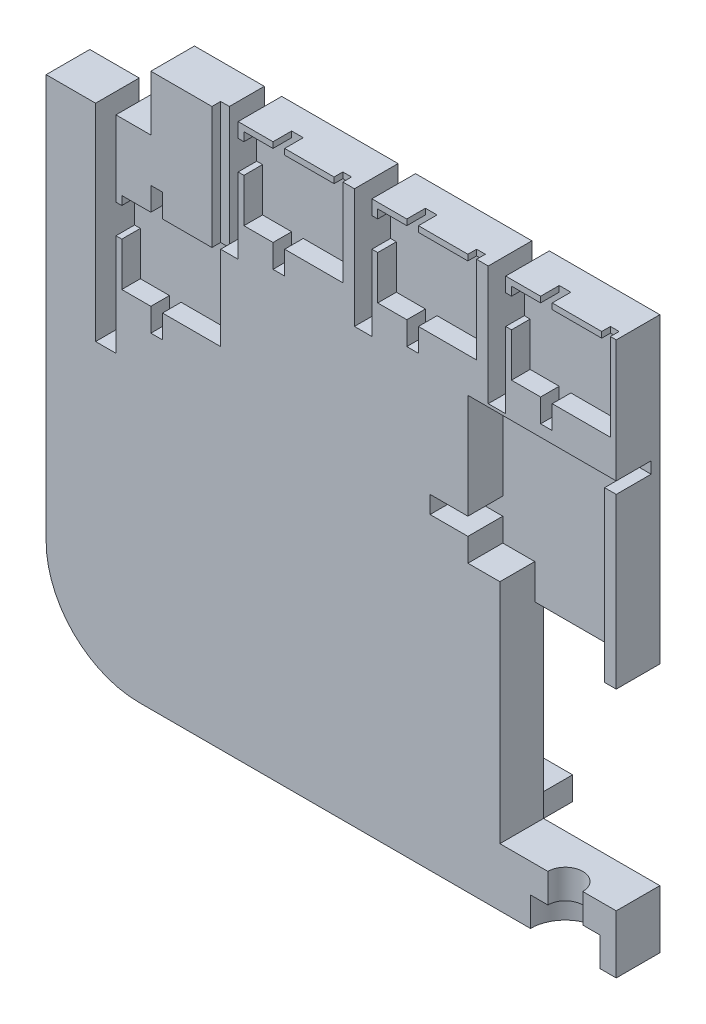
from build123d import *
from OCP.BRepAlgoAPI import BRepAlgoAPI_Cut
from OCP.TopTools import TopTools_ListOfShape
from build123d.topology import SkipClean

# Parameters (mm, degrees)
BOSS_EXTRUDE1_DEPTH = 7.5
CUT_EXTRUDE1_DEPTH  = 3.2
CUT_EXTRUDE4_REACH  = 70.655
SKETCH5_W           = 3
SKETCH5_H           = 17
CUT_EXTRUDE5_REACH  = 70.655
SKETCH8_W           = 12
SKETCH8_H           = 37
CUT_EXTRUDE6_DEPTH  = 3.2
SKETCH10_W          = 10
SKETCH10_H          = 7.5
BOSS_EXTRUDE2_DEPTH = 27.486353186
SKETCH11_W          = 3
SKETCH11_H          = 7.5
CUT_EXTRUDE7_DEPTH  = 3.5
SKETCH12_W          = 2
SKETCH12_H          = 7.5
CUT_EXTRUDE8_DEPTH  = 4
SKETCH13_W          = 2
SKETCH13_H          = 7.5
CUT_EXTRUDE9_DEPTH  = 4
SKETCH14_W          = 7.5
SKETCH14_H          = 9.5
CUT_EXTRUDE10_DEPTH = 6
SKETCH15_W          = 1.5
SKETCH15_H          = 21
SKETCH15_H_2        = 1
CUT_EXTRUDE11_DEPTH = 1.5
SKETCH16_W          = 1.5
SKETCH16_H          = 7.5
CUT_EXTRUDE12_DEPTH = 35.486360958
CUT_EXTRUDE13_DEPTH = 6
SKETCH19_W          = 17.5
SKETCH19_H          = 32
BOSS_EXTRUDE3_DEPTH = 7.5
CUT_EXTRUDE14_DEPTH = 6
SKETCH20_W          = 18
SKETCH20_H          = 6
CUT_EXTRUDE15_DEPTH = 6
SKETCH21_W          = 20
SKETCH21_H          = 33
CUT_EXTRUDE16_DEPTH = 11
CUT_EXTRUDE17_DEPTH = 5
CUT_EXTRUDE18_DEPTH = 10
SKETCH23_W          = 50
SKETCH23_H          = 4
BOSS_EXTRUDE4_DEPTH = 15
SKETCH25_R          = 3.5
CUT_EXTRUDE19_DEPTH = 10


with BuildPart() as part:
    # Sketch1 → Boss-Extrude1 (new body)
    with BuildSketch(Plane.XY):
        with BuildLine():
            Line((-33, -47.5), (49, -47.5))
            Line((49, -47.5), (49, -29.5))
            Line((49, -29.5), (31.5, -29.5))
            Line((31.5, -29.5), (31.5, 2.5))
            Line((31.5, 2.5), (49, 2.5))
            Line((49, 2.5), (49, 47.5))
            Line((49, 47.5), (30, 47.5))
            Line((30, 47.5), (30, 30.5))
            Line((30, 30.5), (27, 30.5))
            Line((27, 30.5), (27, 47.5))
            Line((27, 47.5), (-49, 47.5))
            Line((-49, 47.5), (-49, -31.5))
            ThreePointArc((-49, -31.5), (-44.313708499, -42.813708499), (-33, -47.5))
        make_face()
    extrude(amount=BOSS_EXTRUDE1_DEPTH)

    # Sketch2 → Cut-Extrude1 (cut)
    with BuildSketch(Plane.XY.offset(7.5)):
        Polygon((30, 40), (31, 40), (31, 32.5), (36, 32.5), (36, 28.5), (38, 28.5), (38, 32.5), (48, 32.5), (48, 46.5), (38, 46.5), (38, 47.5), (36, 47.5), (36, 46.5), (31, 46.5), (31, 45), (30, 45), align=None)
        Polygon((-16, 40), (-15, 40), (-15, 32.5), (-10, 32.5), (-10, 28.5), (-8, 28.5), (-8, 32.5), (2, 32.5), (2, 46.5), (-8, 46.5), (-8, 47.5), (-10, 47.5), (-10, 46.5), (-15, 46.5), (-15, 45), (-16, 45), align=None)
        Polygon((7, 40), (8, 40), (8, 32.5), (13, 32.5), (13, 28.5), (15, 28.5), (15, 32.5), (25, 32.5), (25, 46.5), (15, 46.5), (15, 47.5), (13, 47.5), (13, 46.5), (8, 46.5), (8, 45), (7, 45), align=None)
    extrude(amount=-CUT_EXTRUDE1_DEPTH, mode=Mode.SUBTRACT)

    # Sketch5 → Cut-Extrude4 (cut, up to next)
    with BuildSketch(Plane.XY.offset(7.5), mode=Mode.PRIVATE) as cut_extrude4_sk1:
        with Locations((5.5, 39)):
            Rectangle(SKETCH5_W, SKETCH5_H)
    cut_extrude4_tool1 = extrude(cut_extrude4_sk1.sketch, amount=-CUT_EXTRUDE4_REACH, mode=Mode.PRIVATE) & part.part
    # Sketch5 → Cut-Extrude4 (cut, up to next)
    with BuildSketch(Plane.XY.offset(7.5), mode=Mode.PRIVATE) as cut_extrude4_sk2:
        with Locations((-17.5, 39)):
            Rectangle(SKETCH5_W, SKETCH5_H)
    cut_extrude4_tool2 = extrude(cut_extrude4_sk2.sketch, amount=-CUT_EXTRUDE4_REACH, mode=Mode.PRIVATE) & part.part
    add(cut_extrude4_tool1.solids().sort_by_distance((5.5, 39, 7.5))[0], mode=Mode.SUBTRACT)
    add(cut_extrude4_tool2.solids().sort_by_distance((-17.5, 39, 7.5))[0], mode=Mode.SUBTRACT)

    # Sketch8 → Cut-Extrude5 (cut, up to next)
    with BuildSketch(Plane.XY.offset(7.5), mode=Mode.PRIVATE) as cut_extrude5_sk1:
        with Locations((-43, 29)):
            Rectangle(SKETCH8_W, SKETCH8_H)
    cut_extrude5_tool1 = extrude(cut_extrude5_sk1.sketch, amount=-CUT_EXTRUDE5_REACH, mode=Mode.PRIVATE) & part.part
    add(cut_extrude5_tool1.solids().sort_by_distance((-43, 29, 7.5))[0], mode=Mode.SUBTRACT)

    # Sketch9 → Cut-Extrude6 (cut)
    with BuildSketch(Plane.XY.offset(7.5)):
        Polygon((-37, 20), (-36, 20), (-36, 12.5), (-31, 12.5), (-31, 8.5), (-29, 8.5), (-29, 12.5), (-19, 12.5), (-19, 26.5), (-29, 26.5), (-29, 30.5), (-31, 30.5), (-31, 26.5), (-36, 26.5), (-36, 25), (-37, 25), align=None)
    extrude(amount=-CUT_EXTRUDE6_DEPTH, mode=Mode.SUBTRACT)

    # Sketch10 → Boss-Extrude2 (add)
    with BuildSketch(Plane(origin=(0, 10.5, 0), x_dir=(1, 0, 0), z_dir=(0, 1, 0))):
        with Locations((-44, -3.75)):
            Rectangle(SKETCH10_W, SKETCH10_H)
    extrude(amount=BOSS_EXTRUDE2_DEPTH)

    # Sketch11 → Cut-Extrude7 (cut)
    with BuildSketch(Plane(origin=(0, 30.5, 0), x_dir=(1, 0, 0), z_dir=(0, 1, 0))):
        with Locations((-17.5, -3.75)):
            Rectangle(SKETCH11_W, SKETCH11_H)
        with Locations((5.5, -3.75)):
            Rectangle(SKETCH11_W, SKETCH11_H)
        with Locations((28.5, -3.75)):
            Rectangle(SKETCH11_W, SKETCH11_H)
    extrude(amount=-CUT_EXTRUDE7_DEPTH, mode=Mode.SUBTRACT)

    # Sketch12 → Cut-Extrude8 (cut)
    with BuildSketch(Plane(origin=(0, 10.5, 0), x_dir=(1, 0, 0), z_dir=(0, 1, 0))):
        with Locations((-38, -3.75)):
            Rectangle(SKETCH12_W, SKETCH12_H)
    extrude(amount=-CUT_EXTRUDE8_DEPTH, mode=Mode.SUBTRACT)

    # Sketch13 → Cut-Extrude9 (cut)
    with BuildSketch(Plane(origin=(0, 6.5, 0), x_dir=(1, 0, 0), z_dir=(0, 1, 0))):
        with Locations((-38, -3.75)):
            Rectangle(SKETCH13_W, SKETCH13_H)
    extrude(amount=-CUT_EXTRUDE9_DEPTH, mode=Mode.SUBTRACT)

    # Sketch14 → Cut-Extrude10 (cut)
    with BuildSketch(Plane.ZY.offset(37)):
        with Locations((3.75, 42.75)):
            Rectangle(SKETCH14_W, SKETCH14_H)
    extrude(amount=-CUT_EXTRUDE10_DEPTH, mode=Mode.SUBTRACT)

    # Sketch15 → Cut-Extrude11 (cut)
    with BuildSketch(Plane.XY.offset(7.5)):
        with Locations((-19.75, 37)):
            Rectangle(SKETCH15_W, SKETCH15_H)
        with Locations((1.25, 47)):
            Rectangle(SKETCH15_W, SKETCH15_H_2)
        with Locations((24.25, 47)):
            Rectangle(SKETCH15_W, SKETCH15_H_2)
        with Locations((47.25, 47)):
            Rectangle(SKETCH15_W, SKETCH15_H_2)
    extrude(amount=-CUT_EXTRUDE11_DEPTH, mode=Mode.SUBTRACT)


with BuildPart() as cut_extrude12_tool:
    # Sketch16 → Cut-Extrude12 (new body)
    with BuildSketch(Plane(origin=(0, 37.986353186, 0), x_dir=(1, 0, 0), z_dir=(0, 1, 0))):
        with Locations((-39.75, -3.75)):
            Rectangle(SKETCH16_W, SKETCH16_H)
    extrude(amount=-CUT_EXTRUDE12_DEPTH)


with BuildPart() as part_1:
    add(part.part)

    # Cut-Extrude12: cut by cut_extrude12_tool, with a tolerance
    cut_extrude12_stock = TopTools_ListOfShape()
    cut_extrude12_stock.Append(part_1.part.wrapped)
    cut_extrude12_tools = TopTools_ListOfShape()
    cut_extrude12_tools.Append(cut_extrude12_tool.part.wrapped)
    cut_extrude12_cut = BRepAlgoAPI_Cut()
    cut_extrude12_cut.SetArguments(cut_extrude12_stock)
    cut_extrude12_cut.SetTools(cut_extrude12_tools)
    cut_extrude12_cut.SetFuzzyValue(0.00001)
    cut_extrude12_cut.Build()
    add(Compound.cast(cut_extrude12_cut.Shape()).solids(), mode=Mode.REPLACE)

    # Sketch18 → Cut-Extrude13 (cut)
    with SkipClean():  # the faces are left unmerged after this step: merging them gives an invalid solid
        with BuildSketch(Plane.XY.offset(7.5)):
            Polygon((23.5, 5.5), (23.5, 1.5), (47, 1.5), (47, 24.5), (49, 24.5), (49, 26.5), (47, 26.5), (23.5, 26.5), (23.5, 8.5), (17, 8.5), (17, 5.5), align=None)
        extrude(amount=-CUT_EXTRUDE13_DEPTH, mode=Mode.SUBTRACT)

    # Sketch19 → Boss-Extrude3 (add)
    with SkipClean():  # the faces are left unmerged after this step: merging them gives an invalid solid
        with BuildSketch(Plane(origin=(0, 0, 0), x_dir=(-1, 0, 0), z_dir=(0, 0, -1))):
            with Locations((-40.25, -13.5)):
                Rectangle(SKETCH19_W, SKETCH19_H)
        extrude(amount=-BOSS_EXTRUDE3_DEPTH)

    # Sketch18<2> → Cut-Extrude14 (cut)
    with SkipClean():  # the faces are left unmerged after this step: merging them gives an invalid solid
        with BuildSketch(Plane.XY.offset(7.5)):
            Polygon((23.5, 5.5), (23.5, 1.5), (47, 1.5), (47, 24.5), (49, 24.5), (49, 26.5), (47, 26.5), (23.5, 26.5), (23.5, 8.5), (17, 8.5), (17, 5.5), align=None)
        extrude(amount=-CUT_EXTRUDE14_DEPTH, mode=Mode.SUBTRACT)

    # Sketch20 → Cut-Extrude15 (cut)
    with SkipClean():  # the faces are left unmerged after this step: merging them gives an invalid solid
        with BuildSketch(Plane.XY.offset(7.5)):
            with Locations((38, -1.5)):
                Rectangle(SKETCH20_W, SKETCH20_H)
        extrude(amount=-CUT_EXTRUDE15_DEPTH, mode=Mode.SUBTRACT)

    # Sketch21 → Cut-Extrude16 (cut)
    with SkipClean():  # the faces are left unmerged after this step: merging them gives an invalid solid
        with BuildSketch(Plane.XY.offset(7.5)):
            with Locations((39, -21)):
                Rectangle(SKETCH21_W, SKETCH21_H)
        extrude(amount=-CUT_EXTRUDE16_DEPTH, mode=Mode.SUBTRACT)

    # Sketch3 → Cut-Extrude17 (cut)
    with SkipClean():  # the faces are left unmerged after this step: merging them gives an invalid solid
        with BuildSketch(Plane.XZ.offset(47.5)):
            with BuildLine():
                Line((34.25, 7.5), (46.25, 7.5))
                ThreePointArc((46.25, 7.5), (40.25, 1.5), (34.25, 7.5))
            make_face()
        extrude(amount=-CUT_EXTRUDE17_DEPTH, mode=Mode.SUBTRACT)

    # Sketch22 → Cut-Extrude18 (cut)
    with SkipClean():  # the faces are left unmerged after this step: merging them gives an invalid solid
        with BuildSketch(Plane.XZ.offset(42.5)):
            with BuildLine():
                Line((37.25, 7.5), (43.25, 7.5))
                ThreePointArc((43.25, 7.5), (40.25, 4.5), (37.25, 7.5))
            make_face()
        extrude(amount=-CUT_EXTRUDE18_DEPTH, mode=Mode.SUBTRACT)

    # Sketch23 → Boss-Extrude4 (add)
    with SkipClean():  # the faces are left unmerged after this step: merging them gives an invalid solid
        with BuildSketch(Plane(origin=(0, 0, 0), x_dir=(-1, 0, 0), z_dir=(0, 0, -1))):
            with Locations((6, -45.5)):
                Rectangle(SKETCH23_W, SKETCH23_H)
        extrude(amount=BOSS_EXTRUDE4_DEPTH)

    # Sketch25 → Cut-Extrude19 (cut)
    with SkipClean():  # the faces are left unmerged after this step: merging them gives an invalid solid
        with BuildSketch(Plane(origin=(0, -47.5, 0), x_dir=(-1, 0, 0), z_dir=(0, -1, 0))):
            with Locations((-1, 7.5)):
                Circle(SKETCH25_R)
        extrude(amount=-CUT_EXTRUDE19_DEPTH, mode=Mode.SUBTRACT)


solid = part_1.part
